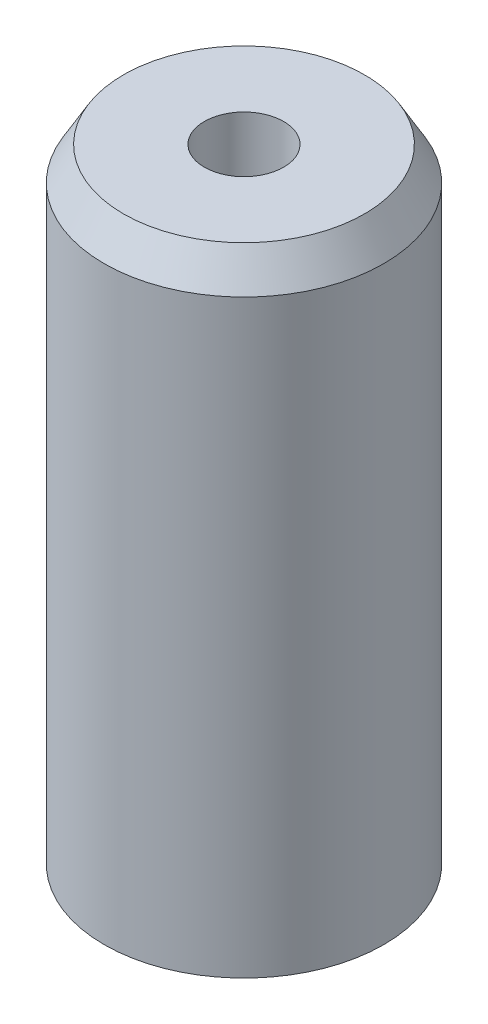
from build123d import *
from OCP.BRepFilletAPI import BRepFilletAPI_MakeChamfer

# Parameters (mm, degrees)
SKETCH1_R           = 15
BOSS_EXTRUDE1_DEPTH = 68.930910774
SKETCH2_R           = 4.253705126
CUT_EXTRUDE1_DEPTH  = 73.121220595
CHAMFER1_SIZE       = 3.586153074
CHAMFER1_SIZE2      = 2.070466443


with BuildPart() as part:
    # Sketch1 → Boss-Extrude1 (new body)
    with BuildSketch(Plane(origin=(0, 0, 0), x_dir=(1, 0, 0), z_dir=(0, 1, 0))):
        Circle(SKETCH1_R)
    extrude(amount=BOSS_EXTRUDE1_DEPTH)

    # Sketch2 → Cut-Extrude1 (cut, through all)
    with BuildSketch(Plane(origin=(0, 0, 0), x_dir=(1, 0, 0), z_dir=(0, 1, 0))):
        Circle(SKETCH2_R)
    extrude(amount=CUT_EXTRUDE1_DEPTH, mode=Mode.SUBTRACT)

    # Chamfer1: one chamfer whose edges measure the first distance from different faces: ONE call of the kernel's chamfer builder (chamfer() names one face for all edges)
    chamfer1_edges_1 = [part.edges().sort_by_distance(p)[0] for p in [
        (-15, 68.930910774, 0),
    ]]
    chamfer1_side_1 = [part.faces().sort_by_distance(p)[0] for p in [
        (-15, 34.465455387, 0),
    ]]
    chamfer1_edges_2 = [part.edges().sort_by_distance(p)[0] for p in [
        (-15, 0, 0),
    ]]
    chamfer1_side_2 = [part.faces().sort_by_distance(p)[0] for p in [
        (-14.575735931, 0, 0),
    ]]
    chamfer1 = BRepFilletAPI_MakeChamfer(part.part.solid().wrapped)
    for e in chamfer1_edges_1:
        chamfer1.Add(CHAMFER1_SIZE, CHAMFER1_SIZE2, e.wrapped, chamfer1_side_1[0].wrapped)  # the first distance lies on this face
    for e in chamfer1_edges_2:
        chamfer1.Add(CHAMFER1_SIZE, CHAMFER1_SIZE2, e.wrapped, chamfer1_side_2[0].wrapped)  # the first distance lies on this face
    add(Compound.cast(chamfer1.Shape()), mode=Mode.REPLACE)


solid = part.part
